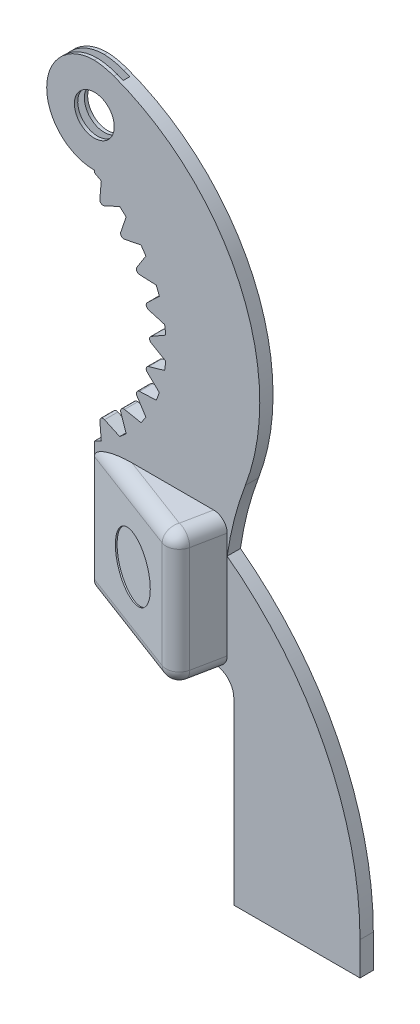
from build123d import *

# Parameters (mm, degrees)
BOSS_EXTRUDE1_DEPTH       = 2
BOSS_EXTRUDE2_DEPTH       = 2
CIRPATTERN1_COUNT         = 5
CIRPATTERN1_ANGLE         = 55
CIRPATTERN2_COPY_1_DEPTH  = 2
CIRPATTERN2_COPY_2_DEPTH  = 2
CIRPATTERN2_COPY_3_DEPTH  = 2
CIRPATTERN2_COPY_4_DEPTH  = 2
CIRPATTERN2_COPY_5_DEPTH  = 2
CIRPATTERN2_COPY_6_DEPTH  = 2
CIRPATTERN2_COPY_7_DEPTH  = 2
CIRPATTERN2_COPY_8_DEPTH  = 2
CIRPATTERN2_COPY_9_DEPTH  = 2
CIRPATTERN2_COPY_10_DEPTH = 2
CIRPATTERN2_COPY_11_DEPTH = 2
CIRPATTERN2_COPY_12_DEPTH = 2
CIRPATTERN2_COPY_13_DEPTH = 2
CIRPATTERN2_COPY_14_DEPTH = 2
CIRPATTERN2_COPY_15_DEPTH = 2
CIRPATTERN2_COPY_16_DEPTH = 2
CIRPATTERN2_COPY_17_DEPTH = 2
CIRPATTERN2_COPY_18_DEPTH = 2
CIRPATTERN2_COPY_19_DEPTH = 2
CIRPATTERN2_COPY_20_DEPTH = 2
BOSS_EXTRUDE3_START       = -20
BOSS_EXTRUDE3_DEPTH       = 20
SKETCH7_R                 = 4.5
CUT_EXTRUDE1_DEPTH        = 0.2
FILLET1_R                 = 2
SKETCH15_R                = 7.170254919
BOSS_EXTRUDE6_DEPTH       = 2
SKETCH16_R                = 3
CUT_EXTRUDE2_DEPTH        = 58.252970512
SKETCH17_W                = 1
SKETCH17_H                = 10
CUT_EXTRUDE3_DEPTH        = 14
SKETCH18_W                = 9
SKETCH18_H                = 1
CUT_EXTRUDE4_DEPTH        = 20
FILLET2_R                 = 10
FILLET3_R                 = 50
FILLET5_R                 = 0.5
FILLET6_R                 = 3


with BuildPart() as part:
    # Sketch1 → Boss-Extrude1 (new body)
    with BuildSketch(Plane.XY):
        with BuildLine():
            Line((-20, -5), (-20, -20))
            Line((-20, -20), (0, -20))
            Line((0, -20), (1, -20))
            Line((1, -20), (1, -50))
            Line((1, -50), (20, -50))
            Line((20, -50), (20, -5))
            Line((20, -5), (0, -5))
            Line((0, -5), (0, 0))
            ThreePointArc((0, 0), (2.5, 30), (-20, 50))
            Line((-20, 50), (-20, 35))
            ThreePointArc((-20, 35), (-9.184405197, 17.5), (-20, 0))
            Line((-20, 0), (-20, -5))
        make_face()
    extrude(amount=BOSS_EXTRUDE1_DEPTH)

    # Sketch2 → Boss-Extrude2 (add)
    with BuildSketch(Plane.XY.offset(2)):
        Polygon((-12.184405197, 17.5), (-8.511312338, 19.620661151), (-8.511312338, 15.379338849), align=None)
    boss_extrude2 = extrude(amount=-BOSS_EXTRUDE2_DEPTH)

    # CirPattern1: Boss-Extrude2 ×5 about axis
    cirpattern1_axis = Axis((-28.75, 17.5, 0), (0, 0, -1))
    for i in range(1, CIRPATTERN1_COUNT):
        add(boss_extrude2.rotate(cirpattern1_axis, i * CIRPATTERN1_ANGLE / (CIRPATTERN1_COUNT - 1)))

    # CirPattern2 copy 1 sketch → CirPattern2 copy 1 (add)
    with BuildSketch(Plane.XY.offset(2)):
        Polygon((-12.184405197, 17.5), (-8.511312338, 19.620661151), (-8.511312338, 15.379338849), align=None)
    extrude(amount=-CIRPATTERN2_COPY_1_DEPTH)

    # CirPattern2 copy 2 sketch → CirPattern2 copy 2 (add)
    with BuildSketch(Plane(origin=(3.335587623, 7.334983183, 2), x_dir=(0.9713420698132613, 0.23768589232617357, 0), z_dir=(0, 0, 1))):
        Polygon((-12.184405197, 17.5), (-8.511312338, 19.620661151), (-8.511312338, 15.379338849), align=None)
    extrude(amount=-CIRPATTERN2_COPY_2_DEPTH)

    # CirPattern2 copy 3 sketch → CirPattern2 copy 3 (add)
    with BuildSketch(Plane(origin=(4.832162185, 15.25258305, 2), x_dir=(0.8870108331782213, 0.46174861323503485, 0), z_dir=(0, 0, 1))):
        Polygon((-12.184405197, 17.5), (-8.511312338, 19.620661151), (-8.511312338, 15.379338849), align=None)
    extrude(amount=-CIRPATTERN2_COPY_3_DEPTH)

    # CirPattern2 copy 4 sketch → CirPattern2 copy 4 (add)
    with BuildSketch(Plane(origin=(4.403946229, 23.298995553, 2), x_dir=(0.7518398074789764, 0.6593458151000701, 0), z_dir=(0, 0, 1))):
        Polygon((-12.184405197, 17.5), (-8.511312338, 19.620661151), (-8.511312338, 15.379338849), align=None)
    extrude(amount=-CIRPATTERN2_COPY_4_DEPTH)

    # CirPattern2 copy 5 sketch → CirPattern2 copy 5 (add)
    with BuildSketch(Plane(origin=(-4.983418609, -6.331955626, 2), x_dir=(0.9713420698132613, -0.23768589232617357, 0), z_dir=(0, 0, 1))):
        Polygon((-12.184405197, 17.5), (-8.511312338, 19.620661151), (-8.511312338, 15.379338849), align=None)
    extrude(amount=-CIRPATTERN2_COPY_5_DEPTH)

    # CirPattern2 copy 6 sketch → CirPattern2 copy 6 (add)
    with BuildSketch(Plane.XY.offset(2)):
        Polygon((-12.184405197, 17.5), (-8.511312338, 19.620661151), (-8.511312338, 15.379338849), align=None)
    extrude(amount=-CIRPATTERN2_COPY_6_DEPTH)

    # CirPattern2 copy 7 sketch → CirPattern2 copy 7 (add)
    with BuildSketch(Plane(origin=(3.335587623, 7.334983183, 2), x_dir=(0.9713420698132613, 0.2376858923261736, 0), z_dir=(0, 0, 1))):
        Polygon((-12.184405197, 17.5), (-8.511312338, 19.620661151), (-8.511312338, 15.379338849), align=None)
    extrude(amount=-CIRPATTERN2_COPY_7_DEPTH)

    # CirPattern2 copy 8 sketch → CirPattern2 copy 8 (add)
    with BuildSketch(Plane(origin=(4.832162185, 15.25258305, 2), x_dir=(0.8870108331782214, 0.4617486132350349, 0), z_dir=(0, 0, 1))):
        Polygon((-12.184405197, 17.5), (-8.511312338, 19.620661151), (-8.511312338, 15.379338849), align=None)
    extrude(amount=-CIRPATTERN2_COPY_8_DEPTH)

    # CirPattern2 copy 9 sketch → CirPattern2 copy 9 (add)
    with BuildSketch(Plane(origin=(-11.329039278, -11.297962211, 2), x_dir=(0.8870108331782213, -0.46174861323503485, 0), z_dir=(0, 0, 1))):
        Polygon((-12.184405197, 17.5), (-8.511312338, 19.620661151), (-8.511312338, 15.379338849), align=None)
    extrude(amount=-CIRPATTERN2_COPY_9_DEPTH)

    # CirPattern2 copy 10 sketch → CirPattern2 copy 10 (add)
    with BuildSketch(Plane(origin=(-4.983418609, -6.331955626, 2), x_dir=(0.9713420698132613, -0.2376858923261736, 0), z_dir=(0, 0, 1))):
        Polygon((-12.184405197, 17.5), (-8.511312338, 19.620661151), (-8.511312338, 15.379338849), align=None)
    extrude(amount=-CIRPATTERN2_COPY_10_DEPTH)

    # CirPattern2 copy 11 sketch → CirPattern2 copy 11 (add)
    with BuildSketch(Plane.XY.offset(2)):
        Polygon((-12.184405197, 17.5), (-8.511312338, 19.620661151), (-8.511312338, 15.379338849), align=None)
    extrude(amount=-CIRPATTERN2_COPY_11_DEPTH)

    # CirPattern2 copy 12 sketch → CirPattern2 copy 12 (add)
    with BuildSketch(Plane(origin=(3.335587623, 7.334983183, 2), x_dir=(0.9713420698132613, 0.2376858923261736, 0), z_dir=(0, 0, 1))):
        Polygon((-12.184405197, 17.5), (-8.511312338, 19.620661151), (-8.511312338, 15.379338849), align=None)
    extrude(amount=-CIRPATTERN2_COPY_12_DEPTH)

    # CirPattern2 copy 13 sketch → CirPattern2 copy 13 (add)
    with BuildSketch(Plane(origin=(-18.673157299, -14.613388815, 2), x_dir=(0.7518398074789764, -0.6593458151000701, 0), z_dir=(0, 0, 1))):
        Polygon((-12.184405197, 17.5), (-8.511312338, 19.620661151), (-8.511312338, 15.379338849), align=None)
    extrude(amount=-CIRPATTERN2_COPY_13_DEPTH)

    # CirPattern2 copy 14 sketch → CirPattern2 copy 14 (add)
    with BuildSketch(Plane(origin=(-11.329039278, -11.297962211, 2), x_dir=(0.8870108331782214, -0.4617486132350349, 0), z_dir=(0, 0, 1))):
        Polygon((-12.184405197, 17.5), (-8.511312338, 19.620661151), (-8.511312338, 15.379338849), align=None)
    extrude(amount=-CIRPATTERN2_COPY_14_DEPTH)

    # CirPattern2 copy 15 sketch → CirPattern2 copy 15 (add)
    with BuildSketch(Plane(origin=(-4.983418609, -6.331955626, 2), x_dir=(0.9713420698132613, -0.2376858923261736, 0), z_dir=(0, 0, 1))):
        Polygon((-12.184405197, 17.5), (-8.511312338, 19.620661151), (-8.511312338, 15.379338849), align=None)
    extrude(amount=-CIRPATTERN2_COPY_15_DEPTH)

    # CirPattern2 copy 16 sketch → CirPattern2 copy 16 (add)
    with BuildSketch(Plane.XY.offset(2)):
        Polygon((-12.184405197, 17.5), (-8.511312338, 19.620661151), (-8.511312338, 15.379338849), align=None)
    extrude(amount=-CIRPATTERN2_COPY_16_DEPTH)

    # CirPattern2 copy 17 sketch → CirPattern2 copy 17 (add)
    with BuildSketch(Plane(origin=(3.335587623, 7.334983183, 2), x_dir=(0.9713420698132613, 0.2376858923261736, 0), z_dir=(0, 0, 1))):
        Polygon((-12.184405197, 17.5), (-8.511312338, 19.620661151), (-8.511312338, 15.379338849), align=None)
    extrude(amount=-CIRPATTERN2_COPY_17_DEPTH)

    # CirPattern2 copy 18 sketch → CirPattern2 copy 18 (add)
    with BuildSketch(Plane(origin=(4.832162185, 15.25258305, 2), x_dir=(0.8870108331782213, 0.46174861323503485, 0), z_dir=(0, 0, 1))):
        Polygon((-12.184405197, 17.5), (-8.511312338, 19.620661151), (-8.511312338, 15.379338849), align=None)
    extrude(amount=-CIRPATTERN2_COPY_18_DEPTH)

    # CirPattern2 copy 19 sketch → CirPattern2 copy 19 (add)
    with BuildSketch(Plane(origin=(4.403946229, 23.298995553, 2), x_dir=(0.7518398074789764, 0.6593458151000701, 0), z_dir=(0, 0, 1))):
        Polygon((-12.184405197, 17.5), (-8.511312338, 19.620661151), (-8.511312338, 15.379338849), align=None)
    extrude(amount=-CIRPATTERN2_COPY_19_DEPTH)

    # CirPattern2 copy 20 sketch → CirPattern2 copy 20 (add)
    with BuildSketch(Plane(origin=(2.07548332, 31.013033637, 2), x_dir=(0.5735764363510444, 0.819152044288993, 0), z_dir=(0, 0, 1))):
        Polygon((-12.184405197, 17.5), (-8.511312338, 19.620661151), (-8.511312338, 15.379338849), align=None)
    extrude(amount=-CIRPATTERN2_COPY_20_DEPTH)

    # Sketch6 → Boss-Extrude3 (add)
    with BuildSketch(Plane(origin=(0, 0, 0), x_dir=(-1, 0, 0), z_dir=(0, 1, 0)).offset(BOSS_EXTRUDE3_START)):
        Polygon((20, 2), (1.405674507, 9), (0, 2), align=None)
    extrude(amount=BOSS_EXTRUDE3_DEPTH)

    # Sketch7 → Cut-Extrude1 (cut)
    with BuildSketch(Plane(origin=(-3.142049109, 0, 8.346326264), x_dir=(0.9358795174345517, 0, 0.3523202078315561), z_dir=(-0.3523202078315561, 0, 0.9358795174345517))):
        with Locations((-8.078805021, -10)):
            Circle(SKETCH7_R)
    extrude(amount=-CUT_EXTRUDE1_DEPTH, mode=Mode.SUBTRACT)

    # Fillet1
    # the kernel refuses this fillet: 2 mm, written as the material it takes off along each edge
    with BuildSketch(Plane(origin=(-2.90325086, -2, 6.299196783), x_dir=(0.9804275360510699, 0, 0.19688028482513967), z_dir=(0, 1, 0))) as fillet1_piece_1_section:
        Polygon((0, 0), (FILLET1_R * 1.02, 0), (FILLET1_R * 1.02, -FILLET1_R * 1.20008027832), (-FILLET1_R * 0.164391571457, -FILLET1_R * 1.00666549123), align=None)
    fillet1_piece_1 = extrude(amount=FILLET1_R * 1.02, mode=Mode.PRIVATE)
    fillet1_piece_1 = fillet1_piece_1 - Plane(origin=(-2.90325086, -2, 6.299196783), x_dir=(-0.4849326452097124, 0, -0.8745515019768195), z_dir=(0, 1, 0)) * Sphere(FILLET1_R, mode=Mode.PRIVATE)
    add(fillet1_piece_1, mode=Mode.SUBTRACT)
    with BuildSketch(Plane(origin=(-2.90325086, -18, 6.299196783), x_dir=(0.9804275360510699, 0, 0.19688028482513967), z_dir=(0, -1, 0))) as fillet1_piece_2_section:
        Polygon((0, 0), (FILLET1_R * 1.02, 0), (FILLET1_R * 1.02, FILLET1_R * 1.20008027832), (-FILLET1_R * 0.164391571457, FILLET1_R * 1.00666549123), align=None)
    fillet1_piece_2 = extrude(amount=FILLET1_R * 1.02, mode=Mode.PRIVATE)
    fillet1_piece_2 = fillet1_piece_2 - Plane(origin=(-2.90325086, -18, 6.299196783), x_dir=(-0.4849326452097124, 0, -0.8745515019768195), z_dir=(0, -1, 0)) * Sphere(FILLET1_R, mode=Mode.PRIVATE)
    add(fillet1_piece_2, mode=Mode.SUBTRACT)
    with BuildSketch(Plane(origin=(-0.942395788, 0, 6.692957352), x_dir=(-0.9804275360510698, 0, -0.19688028482513964), z_dir=(0.19688028482513967, 0, -0.9804275360510699))) as fillet1_piece_3_section:
        with BuildLine():
            CenterArc((FILLET1_R, -FILLET1_R), FILLET1_R, 90, 90)
            Line((0, -FILLET1_R), (0, 0))
            Line((0, 0), (FILLET1_R, 0))
        make_face()
    fillet1_piece_3 = extrude(amount=9.786643765, mode=Mode.PRIVATE)
    fillet1_piece_3 = split(fillet1_piece_3, bisect_by=Plane(origin=(-1.008191374, -0.349909599, 2), z_dir=(0, 0, 1)), keep=Keep.TOP, mode=Mode.PRIVATE)
    add(fillet1_piece_3, mode=Mode.SUBTRACT)
    with BuildSketch(Plane(origin=(-0.942395788, -20, 6.692957352), x_dir=(-0.9804275360510698, -8.88178419700125e-15, -0.19688028482513964), z_dir=(0.19688028482513967, 0, -0.9804275360510699))) as fillet1_piece_4_section:
        with BuildLine():
            CenterArc((FILLET1_R, FILLET1_R), FILLET1_R, 180, 90)
            Line((0, FILLET1_R), (0, 0))
            Line((0, 0), (FILLET1_R, 0))
        make_face()
    fillet1_piece_4 = extrude(amount=9.786643765, mode=Mode.PRIVATE)
    fillet1_piece_4 = split(fillet1_piece_4, bisect_by=Plane(origin=(-0.912007241, -19.549726982, 2), z_dir=(0, 0, 1)), keep=Keep.TOP, mode=Mode.PRIVATE)
    add(fillet1_piece_4, mode=Mode.SUBTRACT)
    with BuildSketch(Plane(origin=(-24.679397587, 0, 0.238398961), x_dir=(0, -1, 0), z_dir=(0.9358795174345516, 0, 0.35232020783155604))) as fillet1_piece_5_section:
        with BuildLine():
            CenterArc((FILLET1_R, FILLET1_R), FILLET1_R, 180, 90)
            Line((0, FILLET1_R), (0, 0))
            Line((0, 0), (FILLET1_R, 0))
        make_face()
    fillet1_piece_5 = extrude(amount=22.515191239, mode=Mode.PRIVATE)
    fillet1_piece_5 = split(fillet1_piece_5, bisect_by=Plane(origin=(-11.12775599, -0.460194973, 2), z_dir=(0, 0, 1)), keep=Keep.TOP, mode=Mode.PRIVATE)
    add(fillet1_piece_5, mode=Mode.SUBTRACT)
    with BuildSketch(Plane(origin=(-24.679397587, -20, 0.238398961), x_dir=(0, 1, 0), z_dir=(0.9358795174345516, 0, 0.35232020783155604))) as fillet1_piece_6:
        with BuildLine():
            CenterArc((FILLET1_R, -FILLET1_R), FILLET1_R, 90, 90)
            Line((0, -FILLET1_R), (0, 0))
            Line((0, 0), (FILLET1_R, 0))
        make_face()
    extrude(amount=22.515191239, mode=Mode.SUBTRACT)
    with BuildSketch(Plane(origin=(-1.405674507, -18, 9), x_dir=(-0.9358795174345511, 0, -0.3523202078315571), z_dir=(0, 1, 0))) as fillet1_piece_7:
        with BuildLine():
            CenterArc((FILLET1_R * 1.17654929247, -FILLET1_R), FILLET1_R, 90, 99.274709646)
            Line((FILLET1_R * 0.18962234028, -FILLET1_R * 1.16116820731), (0, 0))
            Line((0, 0), (FILLET1_R * 1.17654929247, 0))
        make_face()
    extrude(amount=16, mode=Mode.SUBTRACT)

    # Sketch15 → Boss-Extrude6 (add)
    with BuildSketch(Plane.XY.offset(2)):
        with Locations((-20, 42.5)):
            Circle(SKETCH15_R)
    extrude(amount=-BOSS_EXTRUDE6_DEPTH)

    # Sketch16 → Cut-Extrude2 (cut, through all)
    with BuildSketch(Plane.XY.offset(2)):
        with Locations((-20, 42.5)):
            Circle(SKETCH16_R)
    extrude(amount=-CUT_EXTRUDE2_DEPTH, mode=Mode.SUBTRACT)

    # Sketch17 → Cut-Extrude3 (cut)
    with BuildSketch(Plane(origin=(-30, 0, 0), x_dir=(0, 0, -1), z_dir=(1, 0, 0))):
        with Locations((-1, 42.5)):
            Rectangle(SKETCH17_W, SKETCH17_H)
    extrude(amount=CUT_EXTRUDE3_DEPTH, mode=Mode.SUBTRACT)

    # Sketch18 → Cut-Extrude4 (cut)
    with BuildSketch(Plane(origin=(0, 55, 0), x_dir=(-1, 0, 0), z_dir=(0, 1, 0))):
        with Locations((20.639314702, 1)):
            Rectangle(SKETCH18_W, SKETCH18_H)
    extrude(amount=-CUT_EXTRUDE4_DEPTH, mode=Mode.SUBTRACT)

    # Fillet2
    # the kernel refuses this fillet: 10 mm, written as the material it takes off along each edge
    with BuildSketch(Plane(origin=(-20, 50, -7.715216829), x_dir=(0.9526817633527526, -0.30396950138967865, 0), z_dir=(0, 0, 1))) as fillet2_piece_1:
        with BuildLine():
            CenterArc((2.627629196, -9.989485306), FILLET2_R, 87.372310771, 17.26738068)
            Line((0.100232448, -0.314142125), (0, 0))
            ThreePointArc((0, 0), (1.543043366, 0.035389598), (3.086086732, 0))
        make_face()
    extrude(amount=15.930433658, mode=Mode.SUBTRACT)
    with BuildSketch(Plane(origin=(-20, 50, -6.215216829), x_dir=(0, -1, 0), z_dir=(0, 0, 1))) as fillet2_piece_2:
        with BuildLine():
            CenterArc((10.315519613, -0.533204452), FILLET2_R, 159.676133382, 17.26738068)
            ThreePointArc((0.938076245, 2.940058549), (0.435323097, 1.480786633), (0, 0))
            Line((0, 0), (0.329745081, 0))
        make_face()
    extrude(amount=15.930433658, mode=Mode.SUBTRACT)

    # Fillet3
    # the kernel refuses this fillet: 50 mm, written as the material it adds along each edge
    with BuildSketch(Plane(origin=(0, 0, 0), x_dir=(0.43882064391112274, 0.8985746727331166, 0), z_dir=(0, 0, 1))) as fillet3_piece_1:
        with BuildLine():
            CenterArc((10.836486393, -49.78623208), FILLET3_R, 95.3000351, 12.553643777)
            Line((-4.492873364, -2.19410322), (-4.799460559, -1.242260642))
            ThreePointArc((-4.799460559, -1.242260642), (-2.685257326, -0.198476937), (-0.438820644, 0.898574673))
            Line((-0.438820644, 0.898574673), (0.092371197, 0.995724642))
            ThreePointArc((0.092371197, 0.995724642), (3.10896326, 0.856103065), (6.125555323, 0.995724642))
            Line((6.125555323, 0.995724642), (6.217926521, 0))
        make_face()
    extrude(amount=2)
    # the kernel refuses this fillet: 50 mm, written as the material it takes off along each edge
    with BuildSketch(Plane(origin=(20, -5, -100), x_dir=(-1, 0, 0), z_dir=(0, 0, 1))) as fillet3_2_piece_1:
        with BuildLine():
            CenterArc((50, 40), FILLET3_R, 180, 53.130102354)
            Line((0, 40), (-1, 40))
            Line((-1, 40), (-1, 0))
            Line((-1, 0), (0, -1))
            ThreePointArc((0, -1), (10, -1), (19.4, -0.8))
            Line((19.4, -0.8), (20, 0))
        make_face()
    extrude(amount=202, mode=Mode.SUBTRACT)

    # Fillet5
    fillet5_edges = [part.edges().sort_by_distance(p)[0] for p in [
        (-19.248365167, 3.930259152, 1),
        (-12.659140856, 21.437408183, 1),
        (-14.056137952, 25.149140428, 1),
        (-16.295326392, 28.422455608, 1),
        (-19.248365167, 31.069740848, 1),
        (-12.184405197, 17.5, 1),
        (-12.659140856, 13.562591817, 1),
        (-14.056137952, 9.850859572, 1),
        (-16.295326392, 6.577544392, 1),
    ]]
    fillet(fillet5_edges, radius=FILLET5_R)

    # Fillet6
    fillet6_edges = [part.edges().sort_by_distance(p)[0] for p in [
        (1, -20, 1),
    ]]
    fillet(fillet6_edges, radius=FILLET6_R)


solid = part.part
